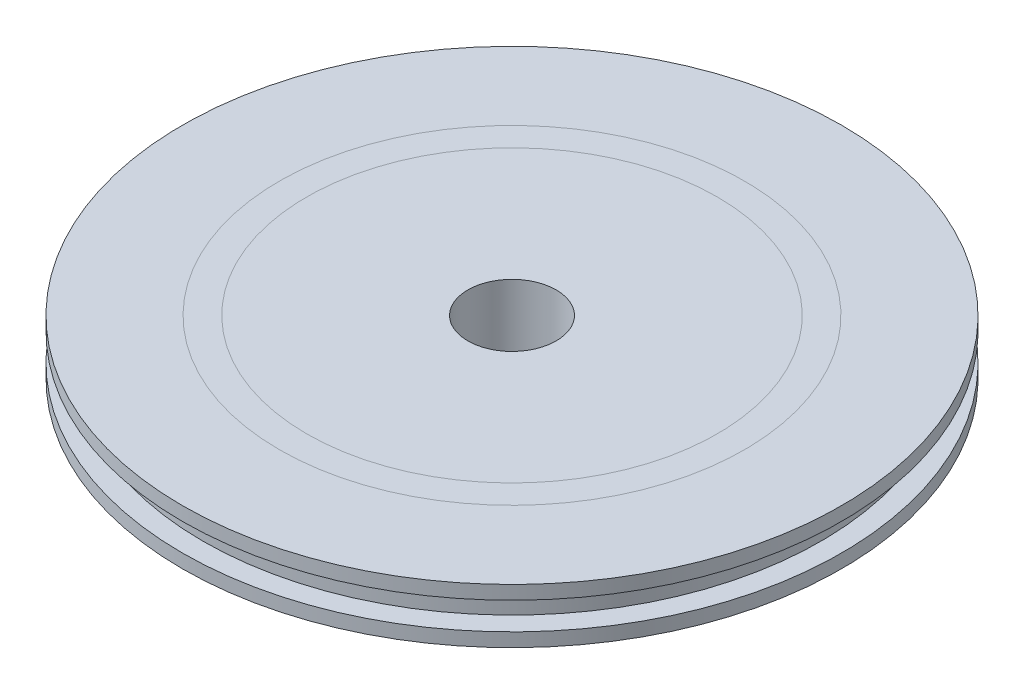
from build123d import *

# Parameters (mm, degrees)
SKETCH6_R                   = 4.1021
F_5_16_CLOSE_FIT_HOLE_DEPTH = 44.553374001
BOSS_EXTRUDE1_START         = 1.016
SKETCH7_R                   = 22.86
SKETCH7_R_2                 = 4.1021
BOSS_EXTRUDE1_DEPTH         = 1.016


with BuildPart() as part:
    # Sketch1 → Revolve1 (revolve)
    with BuildSketch(Plane(origin=(0, 0, 0), x_dir=(0, 0, -1), z_dir=(1, 0, 0))):
        Polygon((0, 0), (0, -5.08), (-30.58668, -5.08), (-30.58668, -3.81), (-28.68168, -3.81), (-28.68168, -1.27), (-30.58668, -1.27), (-30.58668, 0), align=None)
    revolve(axis=Axis((0, 0, 0), (0, -1, 0)))

    # Sketch6 → 5/16 Close Fit hole (cut, through all)
    with BuildSketch(Plane.XZ.offset(5.08)):
        Circle(SKETCH6_R)
    extrude(amount=-F_5_16_CLOSE_FIT_HOLE_DEPTH, mode=Mode.SUBTRACT)

    # Sketch7 → Boss-Extrude1 (add)
    with BuildSketch(Plane.XZ.offset(5.08).offset(BOSS_EXTRUDE1_START)):
        Circle(SKETCH7_R)
        Circle(SKETCH7_R_2, mode=Mode.SUBTRACT)
    extrude(amount=-BOSS_EXTRUDE1_DEPTH)


solid = part.part
